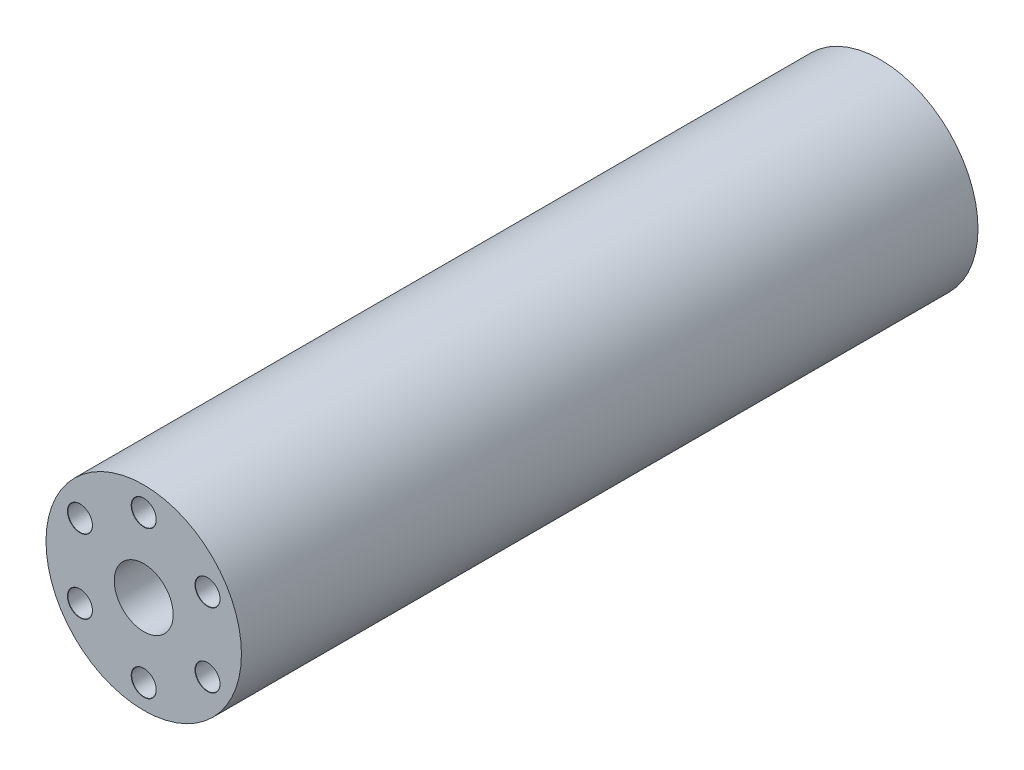
from build123d import *

# Parameters (mm, degrees)
SKETCH1_R                         = 9.95
BOSS_EXTRUDE1_DEPTH               = 75
F_6_0MM_DOWEL_HOLE1_D             = 6
TAP_DRILL_FOR_M3_TAP1_D           = 2.5
TAP_DRILL_FOR_M3_TAP1_DEPTH       = 10
TAP_DRILL_FOR_M3_TAP1_CSINK_D     = 2.55
TAP_DRILL_FOR_M3_TAP1_CSINK_ANGLE = 90
TAP_DRILL_FOR_M3_TAP1_TIP         = 0.751075774
TAP_DRILL_FOR_M3_TAP2_D           = 2.5
TAP_DRILL_FOR_M3_TAP2_DEPTH       = 10
TAP_DRILL_FOR_M3_TAP2_CSINK_D     = 2.55
TAP_DRILL_FOR_M3_TAP2_CSINK_ANGLE = 90
TAP_DRILL_FOR_M3_TAP2_TIP         = 0.751075774


with BuildPart() as part:
    # Sketch1 → Boss-Extrude1 (new body)
    with BuildSketch(Plane.XY):
        Circle(SKETCH1_R)
    extrude(amount=BOSS_EXTRUDE1_DEPTH)

    # Ø6.0mm Dowel Hole1 (through all)
    with Locations(Plane(origin=(0, 0, 0), x_dir=(1, 0, 0), z_dir=(0, 0, -1))):
        with Locations((0, 0)):
            Hole(F_6_0MM_DOWEL_HOLE1_D / 2)

    # Tap Drill for M3 Tap1
    with Locations(Plane(origin=(0, 0, 0), x_dir=(-1, 0, 0), z_dir=(0, 0, -1))):
        with Locations((-6.062177826, -3.5), (0, 7), (6.062177826, -3.5)):
            CounterSinkHole(TAP_DRILL_FOR_M3_TAP1_D / 2, TAP_DRILL_FOR_M3_TAP1_CSINK_D / 2, depth=TAP_DRILL_FOR_M3_TAP1_DEPTH, counter_sink_angle=TAP_DRILL_FOR_M3_TAP1_CSINK_ANGLE)
            with Locations((0, 0, -(TAP_DRILL_FOR_M3_TAP1_DEPTH + TAP_DRILL_FOR_M3_TAP1_TIP / 2))):  # 118° drill point
                Cone(0, TAP_DRILL_FOR_M3_TAP1_D / 2, TAP_DRILL_FOR_M3_TAP1_TIP, mode=Mode.SUBTRACT)

    # Tap Drill for M3 Tap2
    with Locations(Plane.XY.offset(75)):
        with Locations((-6.495190528, 3.75), (0, 7.5), (6.495190528, 3.75), (6.495190528, -3.75), (0, -7.5), (-6.495190528, -3.75)):
            CounterSinkHole(TAP_DRILL_FOR_M3_TAP2_D / 2, TAP_DRILL_FOR_M3_TAP2_CSINK_D / 2, depth=TAP_DRILL_FOR_M3_TAP2_DEPTH, counter_sink_angle=TAP_DRILL_FOR_M3_TAP2_CSINK_ANGLE)
            with Locations((0, 0, -(TAP_DRILL_FOR_M3_TAP2_DEPTH + TAP_DRILL_FOR_M3_TAP2_TIP / 2))):  # 118° drill point
                Cone(0, TAP_DRILL_FOR_M3_TAP2_D / 2, TAP_DRILL_FOR_M3_TAP2_TIP, mode=Mode.SUBTRACT)


solid = part.part
